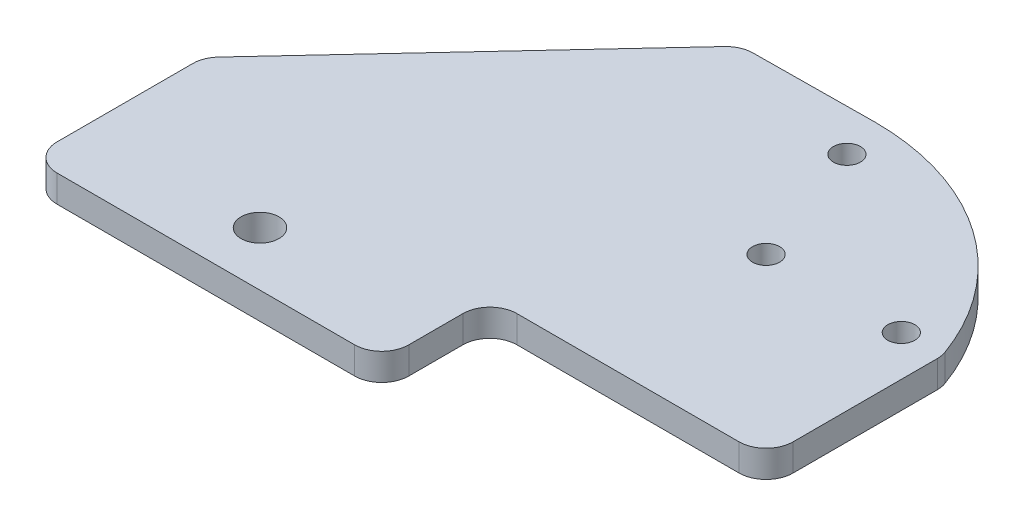
from build123d import *

# Parameters (mm, degrees)
BOSS_EXTRUDE1_DEPTH     = 10
CUT_EXTRUDE4_DEPTH      = 186.960345235
CUT_EXTRUDE4_DEPTH_BACK = 186.960345235
SKETCH2_R               = 5
SKETCH3_R               = 7
CUT_EXTRUDE5_DEPTH      = 186.960345235


with BuildPart() as part:
    # Sketch1 → Boss-Extrude1 (new body)
    with BuildSketch(Plane(origin=(0, 0, 0), x_dir=(1, 0, 0), z_dir=(0, 1, 0))):
        with BuildLine():
            Line((5, 0), (87.1, 0))
            ThreePointArc((87.1, 0), (94.171067812, 2.928932188), (97.1, 10))
            Line((97.1, 10), (97.1, 63.297208828))
            ThreePointArc((97.1, 63.297208828), (96.949532816, 65.025416948), (96.502659338, 66.701617347))
            ThreePointArc((96.502659338, 66.701617347), (62.853663281, 110.72240479), (10.046495568, 127.5))
            Line((10.046495568, 127.5), (-34.953504432, 127.079547292))
            ThreePointArc((-34.953504432, 127.079547292), (-38.861917641, 126.217874558), (-42.119413536, 123.892601626))
            Line((-42.119413536, 123.892601626), (-132.321113421, 26.947294417))
            ThreePointArc((-132.321113421, 26.947294417), (-134.306211211, 23.795285131), (-135, 20.135444575))
            Line((-135, 20.135444575), (-135, -30))
            ThreePointArc((-135, -30), (-132.071067812, -37.071067812), (-125, -40))
            Line((-125, -40), (-15, -40))
            ThreePointArc((-15, -40), (-7.928932188, -37.071067812), (-5, -30))
            Line((-5, -30), (-5, -10))
            ThreePointArc((-5, -10), (-2.071067812, -2.928932188), (5, 0))
        make_face()
    extrude(amount=BOSS_EXTRUDE1_DEPTH)

    # Sketch2 → Cut-Extrude4 (cut, two sides: drawn at the far end of the back side and taken through both)
    with BuildSketch(Plane(origin=(0, 0, 0), x_dir=(1, 0, 0), z_dir=(0, 1, 0)).offset(-CUT_EXTRUDE4_DEPTH_BACK)):
        with Locations((14.998992834, 111.984631039)):
            Circle(SKETCH2_R)
        with Locations((82.1, 65)):
            Circle(SKETCH2_R)
        with Locations((32.1, 65)):
            Circle(SKETCH2_R)
    extrude(amount=CUT_EXTRUDE4_DEPTH + CUT_EXTRUDE4_DEPTH_BACK, mode=Mode.SUBTRACT)

    # Sketch3 → Cut-Extrude5 (cut, through all)
    with BuildSketch(Plane.XZ):
        with Locations((-70, 20)):
            Circle(SKETCH3_R)
    extrude(amount=-CUT_EXTRUDE5_DEPTH, mode=Mode.SUBTRACT)


solid = part.part
